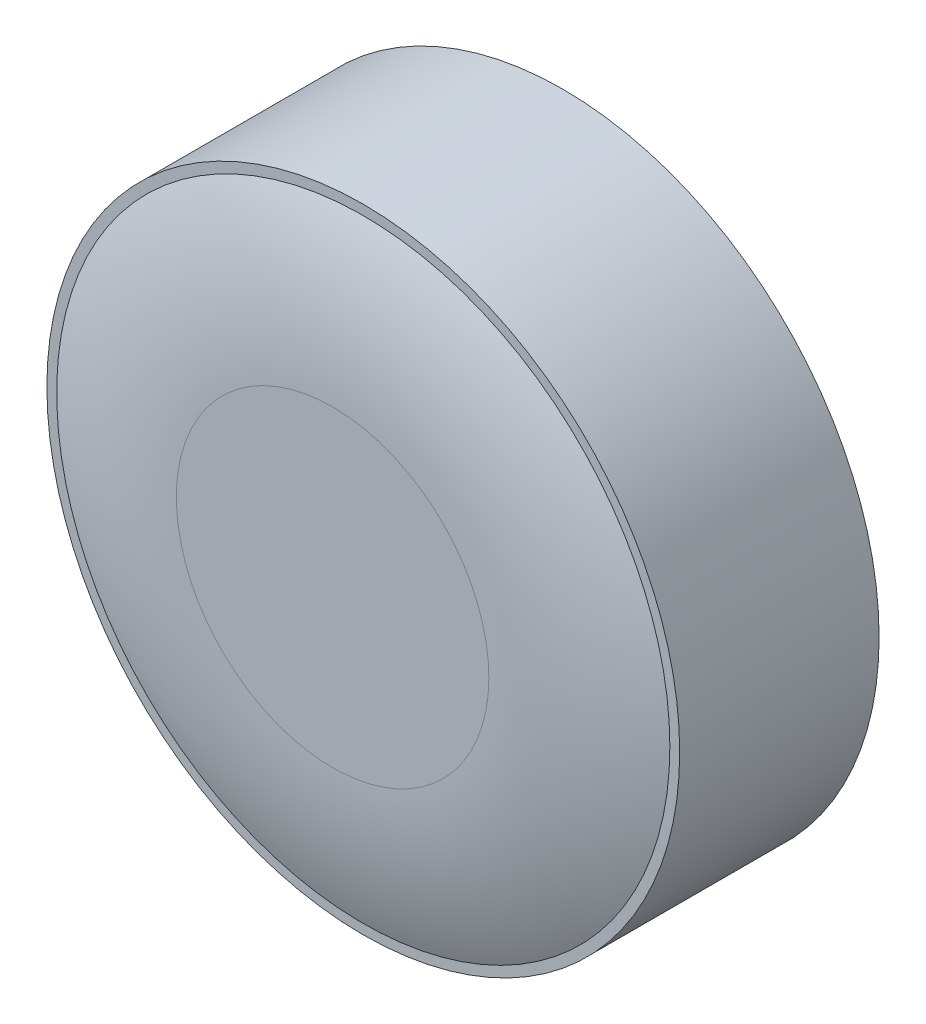
from build123d import *

# Parameters (mm, degrees)
SKETCH1_R           = 8.25
BOSS_EXTRUDE1_DEPTH = 5.2
SKETCH1_4_R         = 7.994032283
BOSS_EXTRUDE3_DEPTH = 6
FILLET1_R           = 10


with BuildPart() as part:
    # Sketch1 → Boss-Extrude1 (new body)
    with BuildSketch(Plane.XY):
        Circle(SKETCH1_R)
    extrude(amount=BOSS_EXTRUDE1_DEPTH)

    # Sketch1<4> → Boss-Extrude3 (add)
    with BuildSketch(Plane.XY):
        Circle(SKETCH1_4_R)
    extrude(amount=BOSS_EXTRUDE3_DEPTH)

    # Fillet1
    # the kernel refuses this fillet: 10 mm, written as the material it takes off along each edge
    with BuildSketch(Plane(origin=(0, 0, 6), x_dir=(1, 0, 0), z_dir=(0, -1, 0))) as fillet1_piece_1:
        with BuildLine():
            CenterArc((4.074848695, -10), FILLET1_R, 66.926081934, 23.073918066)
            Line((4.074848695, 0), (4.074848695, 0.2))
            Line((4.074848695, 0.2), (7.994032283, 0.2))
            Line((7.994032283, 0.2), (8.194032283, 0))
            ThreePointArc((8.194032283, 0), (8.194032283, -0.4), (8.072415955, -0.616))
            Line((8.072415955, -0.616), (7.994032283, -0.8))
        make_face()
    revolve(axis=Axis((0, 0, 6), (0, 0, 1)), mode=Mode.SUBTRACT)


solid = part.part
